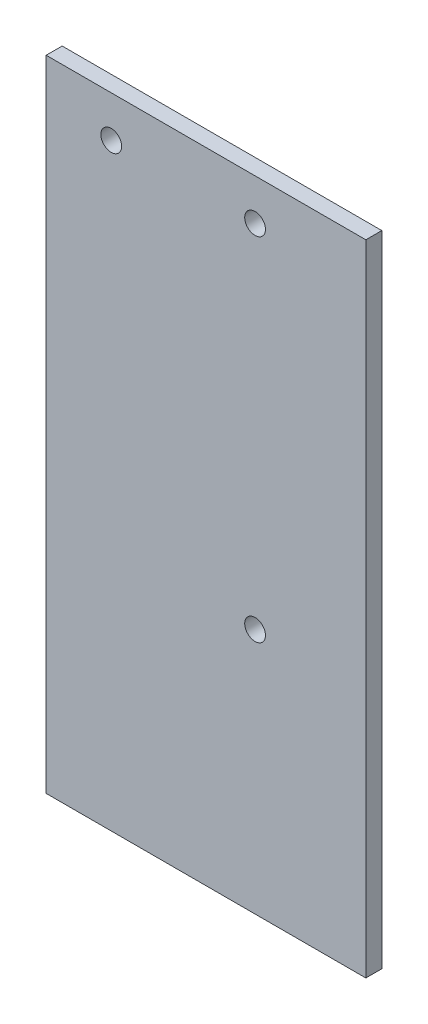
from build123d import *

# Parameters (mm, degrees)
SKETCH1_W           = 101.6
SKETCH1_H           = 50.8
BOSS_EXTRUDE1_DEPTH = 2.54
SKETCH2_R           = 1.651
CUT_EXTRUDE1_DEPTH  = 57.852894385


with BuildPart() as part:
    # Sketch1 → Boss-Extrude1 (new body)
    with BuildSketch(Plane(origin=(0, 0, 0), x_dir=(0, 1, 0), z_dir=(0, 0, 1))):
        Rectangle(SKETCH1_W, SKETCH1_H)
    extrude(amount=BOSS_EXTRUDE1_DEPTH)

    # Sketch2 → Cut-Extrude1 (cut, through all)
    with BuildSketch(Plane.XY.offset(2.54)):
        with Locations((7.798684637, 44.247078221)):
            Circle(SKETCH2_R)
        with Locations((7.798684637, -11.632921779)):
            Circle(SKETCH2_R)
        with Locations((-15.061315363, 44.247078221)):
            Circle(SKETCH2_R)
    extrude(amount=-CUT_EXTRUDE1_DEPTH, mode=Mode.SUBTRACT)


solid = part.part
